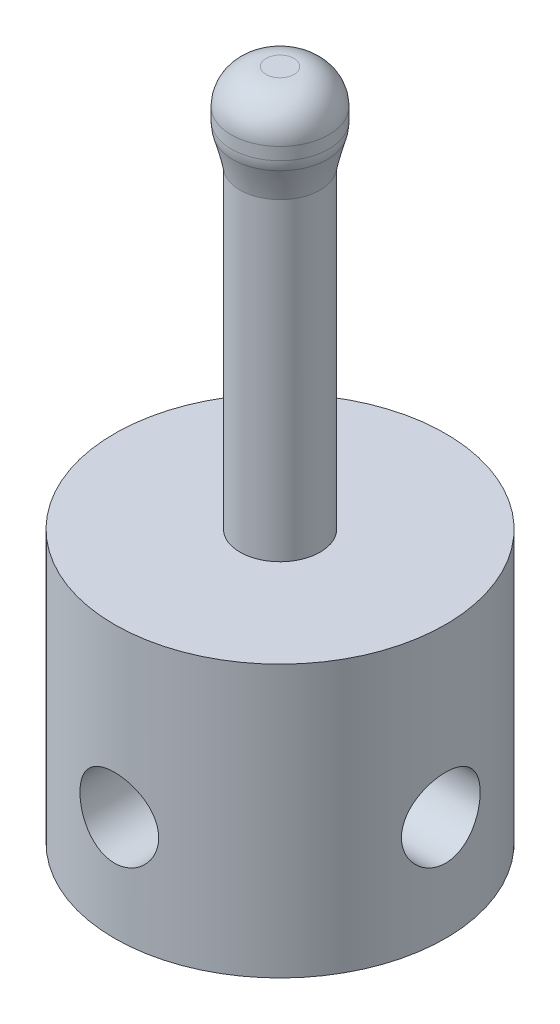
from build123d import *

# Parameters (mm, degrees)
SKETCH1_R           = 12.065
BOSS_EXTRUDE1_DEPTH = 19.812
SKETCH2_R           = 2.921
BOSS_EXTRUDE2_DEPTH = 25.4
SKETCH3_R           = 3.556
BOSS_EXTRUDE3_DEPTH = 3.81
FILLET3_R           = 2.54
SKETCH7_R           = 2.8702
CUT_EXTRUDE1_DEPTH  = 12.7
CIRPATTERN1_COUNT   = 2
CIRPATTERN1_ANGLE   = 90
FILLET4_R           = 2.54


with BuildPart() as part:
    # Sketch1 → Boss-Extrude1 (new body)
    with BuildSketch(Plane(origin=(0, 0, 0), x_dir=(1, 0, 0), z_dir=(0, 1, 0))):
        with Locations(Location((0, 0, 0), (0, 0, 270))):
            Circle(SKETCH1_R)
    extrude(amount=BOSS_EXTRUDE1_DEPTH)

    # Sketch2 → Boss-Extrude2 (add)
    with BuildSketch(Plane(origin=(0, 19.812, 0), x_dir=(1, 0, 0), z_dir=(0, 1, 0))):
        with Locations(Location((0, 0, 0), (0, 0, 270))):
            Circle(SKETCH2_R)
    extrude(amount=BOSS_EXTRUDE2_DEPTH)

    # Sketch3 → Boss-Extrude3 (add)
    with BuildSketch(Plane(origin=(0, 45.212, 0), x_dir=(1, 0, 0), z_dir=(0, 1, 0))):
        with Locations(Location((0, 0, 0), (0, 0, 90))):
            Circle(SKETCH3_R)
    extrude(amount=BOSS_EXTRUDE3_DEPTH)

    # Fillet3
    fillet3_edges = [part.edges().sort_by_distance(p)[0] for p in [
        (0, 49.022, 3.556),
    ]]
    fillet(fillet3_edges, radius=FILLET3_R)

    # Sketch7 → Cut-Extrude1 (cut, symmetric)
    with BuildSketch(Plane.XY):
        with Locations(Location((0, 7.62, 0), (0, 0, 90.000000025))):
            Circle(SKETCH7_R)
    cut_extrude1 = extrude(amount=CUT_EXTRUDE1_DEPTH, both=True, mode=Mode.SUBTRACT)

    # CirPattern1: Cut-Extrude1 ×2 about axis
    cirpattern1_axis = Axis((0, 45.212, 0), (0, -1, 0))
    for i in range(1, CIRPATTERN1_COUNT):
        add(cut_extrude1.rotate(cirpattern1_axis, i * CIRPATTERN1_ANGLE / (CIRPATTERN1_COUNT - 1)), mode=Mode.SUBTRACT)

    # Loft1: read off the stored shape, not the designer's step
    # Loft1: loft between two sections, ruled curve by curve
    loft1_from = [
        Edge.make_bspline([(3.555943144, 45.212, 0.020108599), (3.515725946, 45.212, 7.131994887), (-3.596160342, 45.212, 7.091777689), (-3.555943144, 45.212, -0.020108599), (-3.515725946, 45.212, -7.131994887), (3.596160342, 45.212, -7.091777689), (3.555943144, 45.212, 0.020108599)], [0, 0, 0, 0, 0.5, 0.5, 0.5, 1, 1, 1, 1], 3, [1, 0.333333333, 0.333333333, 1, 0.333333333, 0.333333333, 1]),
    ]
    loft1_to = [
        Edge.make_bspline([(2.781979214, 42.672, 0.890411509), (1.001156196, 42.672, 6.454369936), (-4.562802231, 42.672, 4.673546919), (-2.781979214, 42.672, -0.890411509), (-1.001156196, 42.672, -6.454369936), (4.562802231, 42.672, -4.673546919), (2.781979214, 42.672, 0.890411509)], [0, 0, 0, 0, 0.5, 0.5, 0.5, 1, 1, 1, 1], 3, [1, 0.333333333, 0.333333333, 1, 0.333333333, 0.333333333, 1]),
    ]
    loft1 = Solid(Shell([*[Face.make_surface_from_curves(loft1_from[k], loft1_to[k]) for k in range(1)], Face(Wire(loft1_from)), Face(Wire(loft1_to))]))
    add(loft1)

    # Fillet4
    fillet4_edges = [part.edges().sort_by_distance(p)[0] for p in [
        (-2.521571155, 45.212, 2.507352171),
    ]]
    fillet(fillet4_edges, radius=FILLET4_R)


solid = part.part
